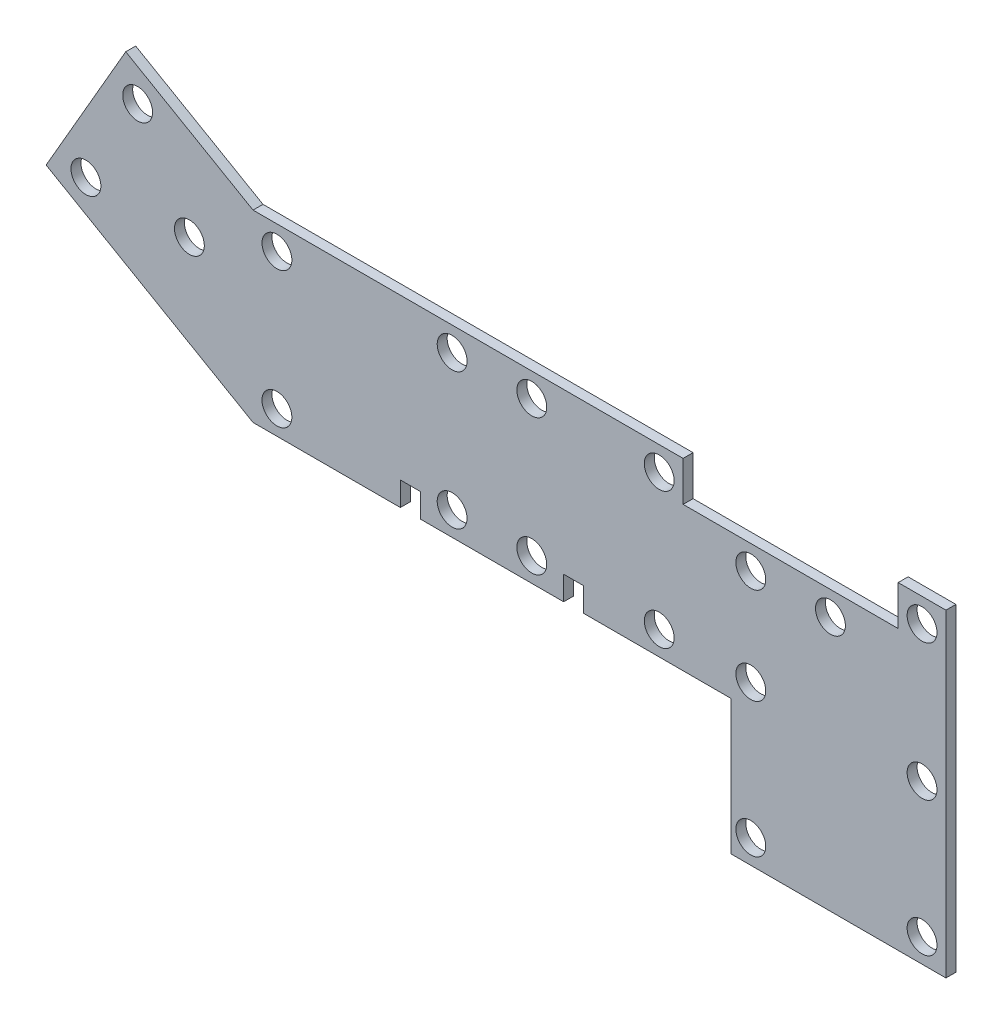
from build123d import *

# Parameters (mm, degrees)
SKETCH1_R           = 4.7625
BOSS_EXTRUDE1_DEPTH = 3.175


with BuildPart() as part:
    # Sketch1 → Boss-Extrude1 (new body)
    with BuildSketch(Plane.XY):
        Polygon((99.06, 0), (0, 0), (-40.591135768, 23.435303163), (-65.991135768, -20.55878735), (0, -58.65878735), (46.99, -58.65878735), (46.99, -51.03878735), (53.34, -51.03878735), (53.34, -58.65878735), (99.06, -58.65878735), (99.06, -51.03878735), (105.41, -51.03878735), (105.41, -58.65878735), (152.4, -58.65878735), (152.4, -101.6), (220.98, -101.6), (220.98, 0), (205.74, 0), (205.74, -12.7), (137.16, -12.7), (137.16, 0), align=None)
        with Locations((7.62, -51.03878735)):
            Circle(SKETCH1_R, mode=Mode.SUBTRACT)
        with Locations((63.5, -51.03878735)):
            Circle(SKETCH1_R, mode=Mode.SUBTRACT)
        with Locations((158.75, -93.98)):
            Circle(SKETCH1_R, mode=Mode.SUBTRACT)
        with Locations((213.36, -93.98)):
            Circle(SKETCH1_R, mode=Mode.SUBTRACT)
        with Locations((88.9, -51.03878735)):
            Circle(SKETCH1_R, mode=Mode.SUBTRACT)
        with Locations((129.54, -51.03878735)):
            Circle(SKETCH1_R, mode=Mode.SUBTRACT)
        with Locations((158.75, -51.03878735)):
            Circle(SKETCH1_R, mode=Mode.SUBTRACT)
        with Locations((213.36, -51.03878735)):
            Circle(SKETCH1_R, mode=Mode.SUBTRACT)
        with Locations((-53.291135768, -17.611742094)):
            Circle(SKETCH1_R, mode=Mode.SUBTRACT)
        with Locations((-20.295567884, -17.611742094)):
            Circle(SKETCH1_R, mode=Mode.SUBTRACT)
        with Locations((-36.793351826, 10.963257906)):
            Circle(SKETCH1_R, mode=Mode.SUBTRACT)
        with Locations((7.62, -7.62)):
            Circle(SKETCH1_R, mode=Mode.SUBTRACT)
        with Locations((63.5, -7.62)):
            Circle(SKETCH1_R, mode=Mode.SUBTRACT)
        with Locations((158.75, -20.32)):
            Circle(SKETCH1_R, mode=Mode.SUBTRACT)
        with Locations((184.15, -20.32)):
            Circle(SKETCH1_R, mode=Mode.SUBTRACT)
        with Locations((88.9, -7.62)):
            Circle(SKETCH1_R, mode=Mode.SUBTRACT)
        with Locations((129.54, -7.62)):
            Circle(SKETCH1_R, mode=Mode.SUBTRACT)
        with Locations((213.36, -7.62)):
            Circle(SKETCH1_R, mode=Mode.SUBTRACT)
    extrude(amount=BOSS_EXTRUDE1_DEPTH)


solid = part.part
